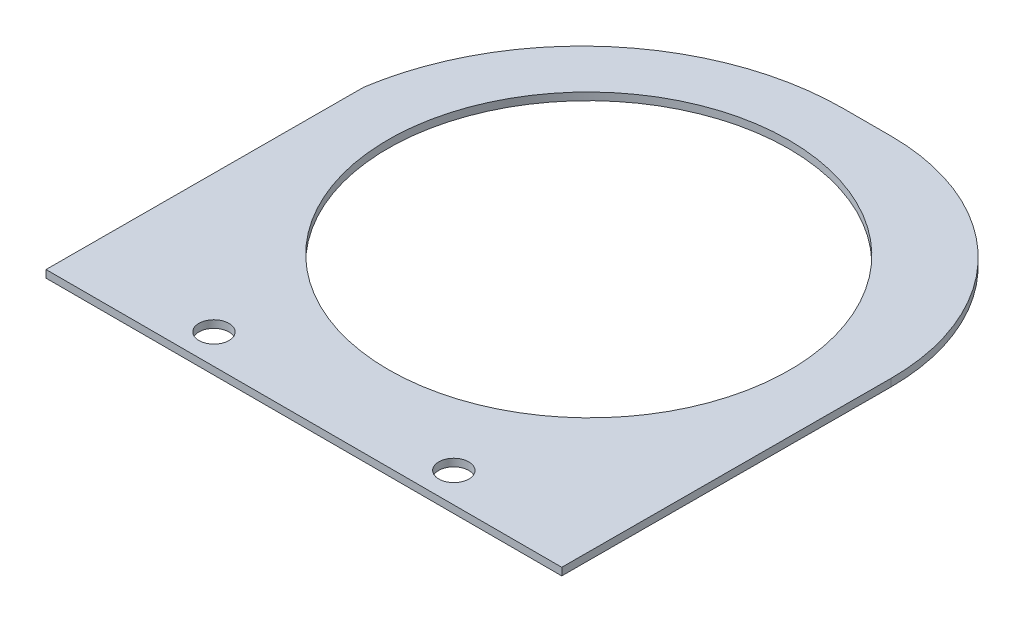
from build123d import *

# Parameters (mm, degrees)
SKETCH1_R           = 6.35
SKETCH1_R_2         = 84.7725
BOSS_EXTRUDE1_DEPTH = 3.175


with BuildPart() as part:
    # Sketch1 → Boss-Extrude1 (new body)
    with BuildSketch(Plane(origin=(0.007312432, -1774.580465895, 2.722061432), x_dir=(0.9999999999660406, 8.241288754560128e-06, -1.2641463547292703e-08), z_dir=(-8.241288754560128e-06, 0.9999952941664769, -0.0030678293600610203))):
        with BuildLine():
            ThreePointArc((105.900547297, 18.94756367), (79.789445905, 81.985338778), (16.751670796, 108.09644017))
            Line((16.751670796, 108.09644017), (-3.319452703, 108.09644017))
            ThreePointArc((-3.319452703, 108.09644017), (-75.377977104, 81.352193983), (-112.539452703, 14.071361837))
            Line((-112.539452703, 14.071361837), (-112.539452703, -120.50355983))
            Line((-112.539452703, -120.50355983), (105.900547297, -120.50355983))
            Line((105.900547297, -120.50355983), (105.900547297, 18.94756367))
        make_face()
        with Locations((-54.119452703, -107.80355983)):
            Circle(SKETCH1_R, mode=Mode.SUBTRACT)
        with Locations((47.480547297, -107.80355983)):
            Circle(SKETCH1_R, mode=Mode.SUBTRACT)
        with Locations((-3.319452703, 0.14644017)):
            Circle(SKETCH1_R_2, mode=Mode.SUBTRACT)
    extrude(amount=BOSS_EXTRUDE1_DEPTH)


solid = part.part
